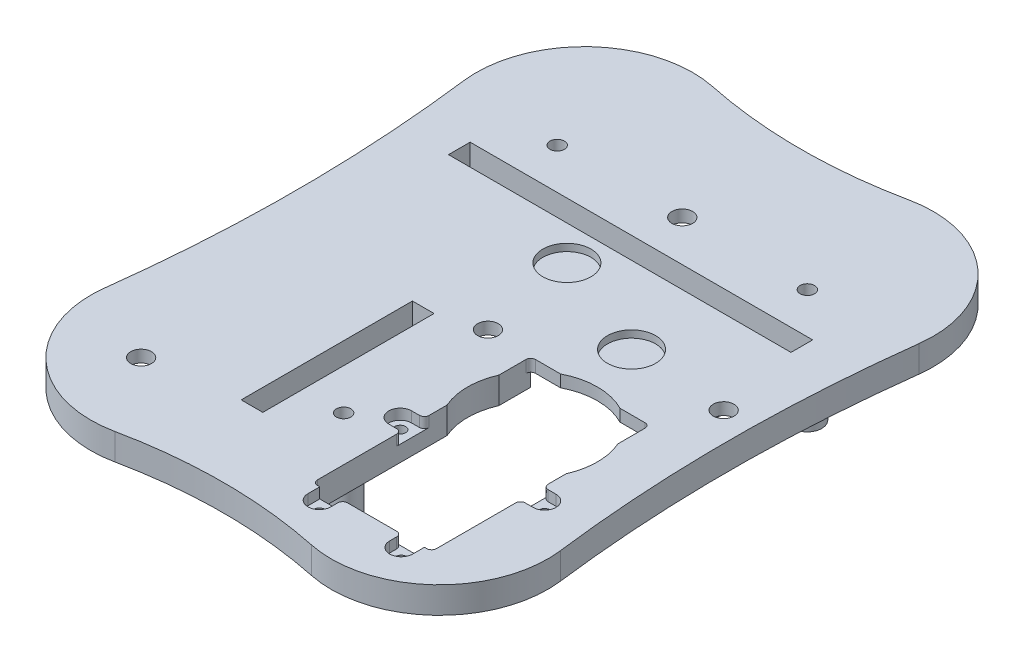
from build123d import *
from build123d.topology import SkipClean

# Parameters (mm, degrees)
A_BASE_O_OUTLINE_R                             = 0.75
A_BASE_O_OUTLINE_R_2                           = 1.5
A_BASE_O_DEPTH                                 = 1.5
SKETCH1_R                                      = 12
SKETCH1_R_2                                    = 5
GEAR_MOUNTING_HOLES_DEPTH                      = 83.615422454
BASE_START                                     = 1
SKETCH2_R                                      = 1.5
SKETCH2_R_2                                    = 0.75
SKETCH2_R_3                                    = 12
BASE_EXTENSION_DEPTH                           = 1
SKETCH3_W                                      = 71.2
SKETCH3_H                                      = 4.5
SKETCH3_W_2                                    = 4.5
SKETCH3_H_2                                    = 35.6
DYNAMIXEL_MOUNTING_SLOTS_DEPTH                 = 83.639627463
SKETCH4_W                                      = 24.55
SKETCH4_H                                      = 2.5
SKETCH4_W_2                                    = 2.5
SKETCH4_H_2                                    = 24.55
SKETCH4_W_3                                    = 15
SKETCH4_W_4                                    = 9
SKETCH4_H_3                                    = 18.55
SKETCH4_H_4                                    = 15
SKETCH4_W_5                                    = 18.55
SKETCH4_H_5                                    = 9
DYNAMIXEL_MOUNTING_PLATFORMS_DEPTH             = 3.1
DYNAMIXEL_MOUNTING_WALLS_DEPTH                 = 5.6
SKETCH6_R                                      = 0.5
SKETCH6_W                                      = 24.75
SKETCH6_H                                      = 45.35
GEAR_DYNAMIXEL_MOUNTING_HOLES_DEPTH            = 83.791412763
GEAR_START                                     = 3
SKETCH7_R                                      = 0.5
GEAR_DYNAMIXEL_MOUNTING_PLATFORMS_DEPTH        = 3
F_8_CLEARANCE_HOLE1_D                          = 4.3053
F_8_CLEARANCE_HOLE1_DEPTH                      = 26.4
F_8_CLEARANCE_HOLE1_TIP                        = 1.293442612
CBORE_FOR_2_SOCKET_HEAD_CAP_SCREW1_D           = 2.2606
CBORE_FOR_2_SOCKET_HEAD_CAP_SCREW1_CBORE_D     = 4.7625
CBORE_FOR_2_SOCKET_HEAD_CAP_SCREW1_CBORE_DEPTH = 2.1844
CBORE_CLEANUP_DEPTH                            = 2.1844
CONTOURING_R                                   = 1
SKETCH14_R                                     = 13.5
GEAR_CLEARANCE_DEPTH                           = 83.99800014
OUTER_START                                    = 3
OUTER_BRIM_DEPTH                               = 3
OUTER_BRIM_FILLER_DEPTH                        = 3
SKETCH18_R                                     = 3.4
CLEARANCE_POST_DEPTH                           = 3
TENDON_START                                   = 21
SKETCH21_R                                     = 3
SKETCH21_R_2                                   = 1.5
TENDON_POSTS_DEPTH                             = 21
TENDON_POST_CHAMFER_SIZE                       = 2
TENDON_POST_CHAMFER_SIZE2                      = 5.494954839
BACK_START                                     = 3
SKETCH22_R                                     = 1.5
BACK_TENDON_POST_BASE_DEPTH                    = 3
FILLET1_R                                      = 1


# Read off the part's stored shape, not the designer's step: a_base_o
with BuildPart() as part:
    # a_base_o outline → a_base_o (new body)
    with BuildSketch(Plane(origin=(0, 0, 0), x_dir=(1, 0, 0), z_dir=(0, 1, 0))):
        with BuildLine():
            ThreePointArc((-47.325593549, -42.28200295), (-40.253272085, -61.61865163), (-20.408173931, -67.104614834))
            ThreePointArc((-20.408173931, -67.104614834), (0, -65), (20.408173931, -67.104614834))
            ThreePointArc((20.408173931, -67.104614834), (40.253272085, -61.61865163), (47.325593549, -42.28200295))
            ThreePointArc((47.325593549, -42.28200295), (45, -5), (47.325593549, 32.28200295))
            ThreePointArc((47.325593549, 32.28200295), (40.253272085, 51.61865163), (20.408173931, 57.104614834))
            ThreePointArc((20.408173931, 57.104614834), (0, 55), (-20.408173931, 57.104614834))
            ThreePointArc((-20.408173931, 57.104614834), (-40.253272085, 51.61865163), (-47.325593549, 32.28200295))
            ThreePointArc((-47.325593549, 32.28200295), (-45, -5), (-47.325593549, -42.28200295))
        make_face()
        with Locations((-31.010420705, -51.088560812)):
            Circle(A_BASE_O_OUTLINE_R, mode=Mode.SUBTRACT)
        with Locations((0, -40)):
            Circle(A_BASE_O_OUTLINE_R_2, mode=Mode.SUBTRACT)
        with Locations((0, -10)):
            Circle(A_BASE_O_OUTLINE_R, mode=Mode.SUBTRACT)
        with Locations((-26, 30.397368307)):
            Circle(A_BASE_O_OUTLINE_R_2, mode=Mode.SUBTRACT)
        with Locations((39, 0)):
            Circle(A_BASE_O_OUTLINE_R, mode=Mode.SUBTRACT)
        with Locations((0, 30.397368307)):
            Circle(A_BASE_O_OUTLINE_R, mode=Mode.SUBTRACT)
        with Locations((26, 30.397368307)):
            Circle(A_BASE_O_OUTLINE_R_2, mode=Mode.SUBTRACT)
    extrude(amount=A_BASE_O_DEPTH)

    # Sketch1 → Gear Mounting Holes (cut, through all)
    with BuildSketch(Plane.XZ):
        with Locations(Location((21.7, 22.435716785, 0), (0, 0, 270))):
            Circle(SKETCH1_R)
        with Locations(Location((18.5, -1.349993211, 0), (0, 0, 270))):
            Circle(SKETCH1_R_2)
        with Locations(Location((-3.801906733, -10.21706466, 0), (0, 0, 270))):
            Circle(SKETCH1_R_2)
    extrude(amount=-GEAR_MOUNTING_HOLES_DEPTH, mode=Mode.SUBTRACT)

    # Sketch2 → Base Extension (add)
    with SkipClean():  # the faces are left unmerged after this step: merging them gives an invalid solid
        with BuildSketch(Plane.XZ.offset(BASE_START)):
            with BuildLine():
                ThreePointArc((-20.408173931, 67.104614834), (-40.253272085, 61.61865163), (-47.325593549, 42.28200295))
                ThreePointArc((-47.325593549, 42.28200295), (-45, 5), (-47.325593549, -32.28200295))
                ThreePointArc((-47.325593549, -32.28200295), (-40.253272085, -51.61865163), (-20.408173931, -57.104614834))
                ThreePointArc((-20.408173931, -57.104614834), (0, -55), (20.408173931, -57.104614834))
                ThreePointArc((20.408173931, -57.104614834), (40.253272085, -51.61865163), (47.325593549, -32.28200295))
                ThreePointArc((47.325593549, -32.28200295), (45, 5), (47.325593549, 42.28200295))
                ThreePointArc((47.325593549, 42.28200295), (40.253272085, 61.61865163), (20.408173931, 67.104614834))
                ThreePointArc((20.408173931, 67.104614834), (0, 65), (-20.408173931, 67.104614834))
            make_face()
            with Locations(Location((26, -30.397368307, 0), (0, 0, 270))):
                Circle(SKETCH2_R, mode=Mode.SUBTRACT)
            with Locations(Location((0, -30.397368307, 0), (0, 0, 90))):
                Circle(SKETCH2_R_2, mode=Mode.SUBTRACT)
            with Locations(Location((-26, -30.397368307, 0), (0, 0, 270))):
                Circle(SKETCH2_R, mode=Mode.SUBTRACT)
            with Locations(Location((39, 0, 0), (0, 0, 90))):
                Circle(SKETCH2_R_2, mode=Mode.SUBTRACT)
            with Locations(Location((0, 40, 0), (0, 0, 270))):
                Circle(SKETCH2_R, mode=Mode.SUBTRACT)
            with Locations(Location((-31.010420705, 51.088560812, 0), (0, 0, 90))):
                Circle(SKETCH2_R_2, mode=Mode.SUBTRACT)
            with Locations(Location((21.7, 22.435716785, 0), (0, 0, 270))):
                Circle(SKETCH2_R_3, mode=Mode.SUBTRACT)
        extrude(amount=-BASE_EXTENSION_DEPTH)

    # Sketch3 → Dynamixel Mounting Slots (cut, through all)
    with SkipClean():  # the faces are left unmerged after this step: merging them gives an invalid solid
        with BuildSketch(Plane.XZ.offset(1)):
            with Locations((0, -19.647368307)):
                Rectangle(SKETCH3_W, SKETCH3_H)
            with Locations((-10.75, 30.5)):
                Rectangle(SKETCH3_W_2, SKETCH3_H_2)
        extrude(amount=-DYNAMIXEL_MOUNTING_SLOTS_DEPTH, mode=Mode.SUBTRACT)

    # Sketch4 → Dynamixel Mounting Platforms (add)
    # profile 1 of 6: a face of its own
    with SkipClean():  # the faces are left unmerged after this step: merging them gives an invalid solid
        with BuildSketch(Plane.XZ.offset(1)):
            with Locations((17.8, -23.147368307)):
                Rectangle(SKETCH4_W, SKETCH4_H)
        # profile 2 of 6: a face of its own
        with BuildSketch(Plane.XZ.offset(1)):
            with Locations((-17.8, -23.147368307)):
                Rectangle(SKETCH4_W, SKETCH4_H)
        # profile 3 of 6: a face of its own
        with BuildSketch(Plane.XZ.offset(1)):
            with Locations((-7.25, 30.5)):
                Rectangle(SKETCH4_W_2, SKETCH4_H_2)
        # profile 4 of 6: a face of its own
        with BuildSketch(Plane.XZ.offset(1)):
            with Locations((-20.5, 30.5)):
                Rectangle(SKETCH4_W_3, SKETCH4_H_2)
            with Locations((-20.5, 30.5)):
                Rectangle(SKETCH4_W_4, SKETCH4_H_3, mode=Mode.SUBTRACT)
        # profile 5 of 6: a face of its own
        with BuildSketch(Plane.XZ.offset(1)):
            with Locations((17.8, -9.897368307)):
                Rectangle(SKETCH4_W, SKETCH4_H_4)
            with Locations((17.8, -9.897368307)):
                Rectangle(SKETCH4_W_5, SKETCH4_H_5, mode=Mode.SUBTRACT)
        # profile 6 of 6: a face of its own
        with BuildSketch(Plane.XZ.offset(1)):
            with Locations((-17.8, -9.897368307)):
                Rectangle(SKETCH4_W, SKETCH4_H_4)
            with Locations((-17.8, -9.897368307)):
                Rectangle(SKETCH4_W_5, SKETCH4_H_5, mode=Mode.SUBTRACT)
        extrude(amount=DYNAMIXEL_MOUNTING_PLATFORMS_DEPTH)

    # Sketch5 → Dynamixel Mounting Walls (add)
    with SkipClean():  # the faces are left unmerged after this step: merging them gives an invalid solid
        with BuildSketch(Plane.XZ.offset(1)):
            Polygon((30.075, -21.897368307), (35.6, -21.897368307), (35.6, -17.397368307), (30.075, -17.397368307), (30.075, -2.397368307), (31.575, -2.397368307), (31.575, -15.897368307), (37.1, -15.897368307), (37.1, -23.397368307), (37.1, -24.397368307), (30.075, -24.397368307), (30.075, -23.397368307), align=None)
            Polygon((-35.6, -21.897368307), (-30.075, -21.897368307), (-30.075, -23.397368307), (-30.075, -24.397368307), (-37.1, -24.397368307), (-37.1, -23.397368307), (-37.1, -15.897368307), (-31.575, -15.897368307), (-31.575, -2.397368307), (-30.075, -2.397368307), (-30.075, -17.397368307), (-35.6, -17.397368307), align=None)
            Polygon((5.525, -2.397368307), (5.525, -17.397368307), (-5.525, -17.397368307), (-5.525, -2.397368307), (-4.025, -2.397368307), (-4.025, -15.897368307), (4.025, -15.897368307), (4.025, -2.397368307), align=None)
            Polygon((-5.525, -21.897368307), (5.525, -21.897368307), (5.525, -23.397368307), (5.525, -24.397368307), (-5.525, -24.397368307), (-5.525, -23.397368307), align=None)
            Polygon((-8.5, 12.7), (-8.5, 18.225), (-7, 18.225), (-6, 18.225), (-6, 11.2), (-7, 11.2), (-14.5, 11.2), (-14.5, 16.725), (-28, 16.725), (-28, 18.225), (-13, 18.225), (-13, 12.7), align=None)
            Polygon((-8.5, 42.775), (-8.5, 48.3), (-13, 48.3), (-13, 42.775), (-28, 42.775), (-28, 44.275), (-14.5, 44.275), (-14.5, 49.8), (-7, 49.8), (-6, 49.8), (-6, 42.775), (-7, 42.775), align=None)
        extrude(amount=DYNAMIXEL_MOUNTING_WALLS_DEPTH)

    # Sketch6 → Gear Dynamixel Mounting Holes (cut, through all)
    with SkipClean():  # the faces are left unmerged after this step: merging them gives an invalid solid
        with BuildSketch(Plane.XZ.offset(1)):
            with Locations(Location((36.7, 34.935716785, 0), (0, 0, 270))):
                Circle(SKETCH6_R)
            with Locations(Location((30.2, 58.235716785, 0), (0, 0, 270))):
                Circle(SKETCH6_R)
            with Locations(Location((13.2, 58.235716785, 0), (0, 0, 270))):
                Circle(SKETCH6_R)
            with Locations(Location((6.7, 34.935716785, 0), (0, 0, 270))):
                Circle(SKETCH6_R)
            with Locations((21.7, 33.110716785)):
                Rectangle(SKETCH6_W, SKETCH6_H)
        extrude(amount=-GEAR_DYNAMIXEL_MOUNTING_HOLES_DEPTH, mode=Mode.SUBTRACT)

    # Sketch7 → Gear Dynamixel Mounting Platforms (add)
    with SkipClean():  # the faces are left unmerged after this step: merging them gives an invalid solid
        with BuildSketch(Plane.XZ.offset(1).offset(GEAR_START)):
            Polygon((34.075, 10.435716785), (34.075, 55.785716785), (9.325, 55.785716785), (9.325, 10.435716785), (3.7, 13.683312049), (3.7, 55.785716785), (9.325, 61.410716785), (34.075, 61.410716785), (39.7, 55.785716785), (39.7, 13.683312049), align=None)
            with Locations(Location((36.7, 34.935716785, 0), (0, 0, 270))):
                Circle(SKETCH7_R, mode=Mode.SUBTRACT)
            with Locations(Location((30.2, 58.235716785, 0), (0, 0, 270))):
                Circle(SKETCH7_R, mode=Mode.SUBTRACT)
            with Locations(Location((13.2, 58.235716785, 0), (0, 0, 270))):
                Circle(SKETCH7_R, mode=Mode.SUBTRACT)
            with Locations(Location((6.7, 34.935716785, 0), (0, 0, 270))):
                Circle(SKETCH7_R, mode=Mode.SUBTRACT)
        extrude(amount=-GEAR_DYNAMIXEL_MOUNTING_PLATFORMS_DEPTH)

    # #8 Clearance Hole1
    with Locations(Plane(origin=(0, 1.5, 0), x_dir=(1, 0, 0), z_dir=(0, 1, 0))):
        with Locations((0, 30.397368307), (-31.010420705, -51.088560812), (0, -10), (39, 0)):
            Hole(F_8_CLEARANCE_HOLE1_D / 2, depth=F_8_CLEARANCE_HOLE1_DEPTH)
            with Locations((0, 0, -(F_8_CLEARANCE_HOLE1_DEPTH + F_8_CLEARANCE_HOLE1_TIP / 2))):  # 118° drill point
                Cone(0, F_8_CLEARANCE_HOLE1_D / 2, F_8_CLEARANCE_HOLE1_TIP, mode=Mode.SUBTRACT)

    # CBORE for #2 Socket Head Cap Screw1 (through all)
    with Locations(Plane(origin=(0, 1.5, 0), x_dir=(1, 0, 0), z_dir=(0, 1, 0))):
        with Locations((36.7, -34.935716785), (30.2, -58.235716785), (13.2, -58.235716785), (6.7, -34.935716785)):
            CounterBoreHole(CBORE_FOR_2_SOCKET_HEAD_CAP_SCREW1_D / 2, CBORE_FOR_2_SOCKET_HEAD_CAP_SCREW1_CBORE_D / 2, CBORE_FOR_2_SOCKET_HEAD_CAP_SCREW1_CBORE_DEPTH)

    # Sketch13 → CBORE Cleanup (cut)
    with SkipClean():  # the faces are left unmerged after this step: merging them gives an invalid solid
        with BuildSketch(Plane(origin=(0, 1.5, 0), x_dir=(1, 0, 0), z_dir=(0, 1, 0))):
            with BuildLine():
                Line((6.7, -37.316966785), (9.325, -37.316966785))
                Line((9.325, -37.316966785), (9.325, -32.554466785))
                Line((9.325, -32.554466785), (6.7, -32.554466785))
                ThreePointArc((6.7, -32.554466785), (8.383798023, -33.251918762), (9.08125, -34.935716785))
                ThreePointArc((9.08125, -34.935716785), (8.383798023, -36.619514808), (6.7, -37.316966785))
            make_face()
            with BuildLine():
                Line((34.075, -32.554466785), (34.075, -37.316966785))
                Line((34.075, -37.316966785), (36.7, -37.316966785))
                ThreePointArc((36.7, -37.316966785), (34.31875, -34.935716785), (36.7, -32.554466785))
                Line((36.7, -32.554466785), (34.075, -32.554466785))
            make_face()
            with BuildLine():
                Line((15.58125, -58.235716785), (15.58125, -55.785716785))
                Line((15.58125, -55.785716785), (10.81875, -55.785716785))
                Line((10.81875, -55.785716785), (10.81875, -58.235716785))
                ThreePointArc((10.81875, -58.235716785), (13.2, -55.854466785), (15.58125, -58.235716785))
            make_face()
            with BuildLine():
                Line((32.58125, -58.235716785), (32.58125, -55.785716785))
                Line((32.58125, -55.785716785), (27.81875, -55.785716785))
                Line((27.81875, -55.785716785), (27.81875, -58.235716785))
                ThreePointArc((27.81875, -58.235716785), (30.2, -55.854466785), (32.58125, -58.235716785))
            make_face()
        extrude(amount=-CBORE_CLEANUP_DEPTH, mode=Mode.SUBTRACT)

    # Contouring
    # the kernel refuses this fillet: 1 mm, written as the material it adds along each edge
    with BuildSketch(Plane(origin=(34.075, -4, 55.785716785), x_dir=(-1, 0, 0), z_dir=(0, 1, 0))) as contouring_piece_1:
        with BuildLine():
            CenterArc((CONTOURING_R, -CONTOURING_R), CONTOURING_R, 90, 90)
            Line((0, -CONTOURING_R), (0, 0))
            Line((0, 0), (CONTOURING_R, 0))
        make_face()
    extrude(amount=3)
    with BuildSketch(Plane(origin=(9.325, -4, 55.785716785), x_dir=(1, 0, 0), z_dir=(0, 1, 0))) as contouring_piece_2:
        with BuildLine():
            CenterArc((CONTOURING_R, CONTOURING_R), CONTOURING_R, 180, 90)
            Line((0, CONTOURING_R), (0, 0))
            Line((0, 0), (CONTOURING_R, 0))
        make_face()
    extrude(amount=3)
    with BuildSketch(Plane(origin=(9.325, -1, 10.435716785), x_dir=(1, 0, 0), z_dir=(0, 1, 0)), Plane(origin=(34.075, -1, 10.435716785), x_dir=(0, 0, 1), z_dir=(0, 1, 0)), Plane(origin=(34.075, -1, 55.785716785), x_dir=(-1, 0, 0), z_dir=(0, 1, 0))) as contouring_piece_3:
        with BuildLine():
            CenterArc((CONTOURING_R, -CONTOURING_R), CONTOURING_R, 90, 90)
            Line((0, -CONTOURING_R), (0, 0))
            Line((0, 0), (CONTOURING_R, 0))
        make_face()
    extrude(amount=2.5)
    with BuildSketch(Plane(origin=(-14.5, 1.5, 16.725), x_dir=(-1, 0, 0), z_dir=(0, -1, 0)), Plane(origin=(-31.575, 1.5, -15.897368307), x_dir=(0, 0, 1), z_dir=(0, -1, 0)), Plane(origin=(4.025, 1.5, -15.897368307), x_dir=(0, 0, 1), z_dir=(0, -1, 0))) as contouring_piece_4:
        with BuildLine():
            CenterArc((CONTOURING_R, CONTOURING_R), CONTOURING_R, 180, 90)
            Line((0, CONTOURING_R), (0, 0))
            Line((0, 0), (CONTOURING_R, 0))
        make_face()
    extrude(amount=8.1)
    with BuildSketch(Plane(origin=(-14.5, 1.5, 44.275), x_dir=(-1, 0, 0), z_dir=(0, -1, 0)), Plane(origin=(31.575, 1.5, -15.897368307), x_dir=(0, 0, 1), z_dir=(0, -1, 0))) as contouring_piece_5:
        with BuildLine():
            CenterArc((CONTOURING_R, -CONTOURING_R), CONTOURING_R, 90, 90)
            Line((0, -CONTOURING_R), (0, 0))
            Line((0, 0), (CONTOURING_R, 0))
        make_face()
    extrude(amount=8.1)
    with BuildSketch(Plane(origin=(-4.025, 1.5, -15.897368307), x_dir=(1, 0, 0), z_dir=(0, -1, 0))) as contouring_piece_6_section:
        with BuildLine():
            CenterArc((CONTOURING_R, CONTOURING_R), CONTOURING_R, 180, 90)
            Line((0, CONTOURING_R), (0, 0))
            Line((0, 0), (CONTOURING_R, 0))
        make_face()
    contouring_piece_6 = extrude(amount=8.1, mode=Mode.PRIVATE)
    contouring_piece_6 = split(contouring_piece_6, bisect_by=Plane(origin=(-3.796335068, 0, -15.687736344), z_dir=(0, -1, 0)), keep=Keep.TOP, mode=Mode.PRIVATE)
    add(contouring_piece_6)
    with BuildSketch(Plane(origin=(9.325, -1, 55.785716785), x_dir=(1, 0, 0), z_dir=(0, 1, 0))) as contouring_piece_7:
        with BuildLine():
            CenterArc((CONTOURING_R, CONTOURING_R), CONTOURING_R, 180, 90)
            Line((0, CONTOURING_R), (0, 0))
            Line((0, 0), (CONTOURING_R, 0))
        make_face()
    extrude(amount=2.5)
    # the kernel refuses this fillet: 1 mm, written as the material it takes off along each edge
    with BuildSketch(Plane(origin=(34.075, -5.035533906, 61.410716785), x_dir=(0.7071067811865475, 0, -0.7071067811865475), z_dir=(0, 1, 0)), Plane(origin=(39.7, -5.035533906, 55.785716785), x_dir=(0, 0, -1), z_dir=(0, 1, 0)), Plane(origin=(9.325, -5.035533906, 61.410716785), x_dir=(1, 0, 0), z_dir=(0, 1, 0)), Plane(origin=(3.7, -5.035533906, 55.785716785), x_dir=(0.7071067811865427, 0, 0.7071067811865523), z_dir=(0, 1, 0))) as contouring_2_piece_1:
        with BuildLine():
            CenterArc((CONTOURING_R * 0.414213562373, CONTOURING_R), CONTOURING_R, 225, 45)
            Line((-CONTOURING_R * 0.292893218813, CONTOURING_R * 0.292893218813), (0, 0))
            Line((0, 0), (CONTOURING_R * 0.414213562373, 0))
        make_face()
    extrude(amount=4.035533906, mode=Mode.SUBTRACT)
    with BuildSketch(Plane(origin=(3.7, -5.443375673, 13.683312049), x_dir=(0, 0, 1), z_dir=(0, 1, 0)), Plane(origin=(39.7, -5.443375673, 13.683312049), x_dir=(-0.8660254037844412, 0, -0.49999999999999567), z_dir=(0, 1, 0))) as contouring_2_piece_2:
        with BuildLine():
            CenterArc((CONTOURING_R * 0.57735026919, CONTOURING_R), CONTOURING_R, 210, 60)
            Line((-CONTOURING_R * 0.288675134595, CONTOURING_R * 0.5), (0, 0))
            Line((0, 0), (CONTOURING_R * 0.57735026919, 0))
        make_face()
    extrude(amount=4.443375673, mode=Mode.SUBTRACT)
    with BuildSketch(Plane(origin=(27.575, -6.6, -2.397368307), x_dir=(0, 1, 0), z_dir=(1, 0, 0)), Plane(origin=(1.525, -6.6, -2.397368307), x_dir=(0, 1, 0), z_dir=(1, 0, 0)), Plane(origin=(-8.025, -6.6, -2.397368307), x_dir=(0, 1, 0), z_dir=(1, 0, 0)), Plane(origin=(-34.075, -6.6, -2.397368307), x_dir=(0, 1, 0), z_dir=(1, 0, 0)), Plane(origin=(-28, -6.6, 14.225), x_dir=(0, 1, 0), z_dir=(0, 0, 1)), Plane(origin=(-28, -6.6, 40.275), x_dir=(0, 1, 0), z_dir=(0, 0, 1))) as contouring_2_piece_3:
        with BuildLine():
            CenterArc((CONTOURING_R, -CONTOURING_R), CONTOURING_R, 90, 90)
            Line((0, -CONTOURING_R), (0, 0))
            Line((0, 0), (CONTOURING_R, 0))
        make_face()
    extrude(amount=6.5, mode=Mode.SUBTRACT)
    with BuildSketch(Plane(origin=(-30.075, -6.6, -19.397368307), x_dir=(-1, 0, 0), z_dir=(0, 0, -1)), Plane(origin=(-11, -6.6, 18.225), x_dir=(0, 0, -1), z_dir=(1, 0, 0))) as contouring_2_piece_4:
        with BuildLine():
            CenterArc((CONTOURING_R, CONTOURING_R), CONTOURING_R, 180, 90)
            Line((0, CONTOURING_R), (0, 0))
            Line((0, 0), (CONTOURING_R, 0))
        make_face()
    extrude(amount=7.5, mode=Mode.SUBTRACT)
    with BuildSketch(Plane(origin=(-5.525, -6.6, -26.897368307), x_dir=(0, 1, 0), z_dir=(0, 0, 1)), Plane(origin=(5.525, -6.6, -19.397368307), x_dir=(0, 1, 0), z_dir=(0, 0, -1)), Plane(origin=(30.075, -6.6, -26.897368307), x_dir=(0, 1, 0), z_dir=(0, 0, 1)), Plane(origin=(-3.5, -6.6, 42.775), x_dir=(0, 1, 0), z_dir=(-1, 0, 0))) as contouring_2_piece_5:
        with BuildLine():
            CenterArc((CONTOURING_R, -CONTOURING_R), CONTOURING_R, 90, 90)
            Line((0, -CONTOURING_R), (0, 0))
            Line((0, 0), (CONTOURING_R, 0))
        make_face()
    extrude(amount=7.5, mode=Mode.SUBTRACT)
    with BuildSketch(Plane(origin=(30.075, -4.1, -17.397368307), x_dir=(1, 0, 0), z_dir=(0, -1, 0)), Plane(origin=(-5.525, -4.1, -17.397368307), x_dir=(1, 0, 0), z_dir=(0, -1, 0)), Plane(origin=(-13, -4.1, 42.775), x_dir=(0, 0, 1), z_dir=(0, -1, 0))) as contouring_2_piece_6:
        with BuildLine():
            CenterArc((CONTOURING_R, CONTOURING_R), CONTOURING_R, 180, 90)
            Line((0, CONTOURING_R), (0, 0))
            Line((0, 0), (CONTOURING_R, 0))
        make_face()
    extrude(amount=5, mode=Mode.SUBTRACT)
    with BuildSketch(Plane(origin=(5.525, -4.1, -17.397368307), x_dir=(-1, 0, 0), z_dir=(0, -1, 0)), Plane(origin=(-30.075, -4.1, -17.397368307), x_dir=(-1, 0, 0), z_dir=(0, -1, 0)), Plane(origin=(-13, -4.1, 18.225), x_dir=(0, 0, -1), z_dir=(0, -1, 0))) as contouring_2_piece_7:
        with BuildLine():
            CenterArc((CONTOURING_R, -CONTOURING_R), CONTOURING_R, 90, 90)
            Line((0, -CONTOURING_R), (0, 0))
            Line((0, 0), (CONTOURING_R, 0))
        make_face()
    extrude(amount=5, mode=Mode.SUBTRACT)
    with BuildSketch(Plane(origin=(9.325, 4, 37.316966785), x_dir=(0, 0, 1), z_dir=(0, -1, 0)), Plane(origin=(34.075, 4, 32.554466785), x_dir=(0, 0, -1), z_dir=(0, -1, 0))) as contouring_2_piece_8:
        with BuildLine():
            CenterArc((CONTOURING_R, CONTOURING_R), CONTOURING_R, 180, 90)
            Line((0, CONTOURING_R), (0, 0))
            Line((0, 0), (CONTOURING_R, 0))
        make_face()
    extrude(amount=4.6844, mode=Mode.SUBTRACT)
    with BuildSketch(Plane(origin=(27.81875, 4, 55.785716785), x_dir=(-1, 0, 0), z_dir=(0, -1, 0)), Plane(origin=(15.58125, 4, 55.785716785), x_dir=(0, 0, 1), z_dir=(0, -1, 0)), Plane(origin=(34.075, 4, 37.316966785), x_dir=(0, 0, 1), z_dir=(0, -1, 0)), Plane(origin=(9.325, 4, 32.554466785), x_dir=(0, 0, -1), z_dir=(0, -1, 0))) as contouring_2_piece_9:
        with BuildLine():
            CenterArc((CONTOURING_R, -CONTOURING_R), CONTOURING_R, 90, 90)
            Line((0, -CONTOURING_R), (0, 0))
            Line((0, 0), (CONTOURING_R, 0))
        make_face()
    extrude(amount=4.6844, mode=Mode.SUBTRACT)

    # Sketch14 → Gear Clearance (cut, through all)
    with BuildSketch(Plane(origin=(0, 1.5, 0), x_dir=(1, 0, 0), z_dir=(0, 1, 0))):
        with Locations((21.7, -22.435716785)):
            Circle(SKETCH14_R)
    extrude(amount=-GEAR_CLEARANCE_DEPTH, mode=Mode.SUBTRACT)

    # Sketch16 → Outer Brim (add)
    with BuildSketch(Plane.XZ.offset(1).offset(OUTER_START)):
        with BuildLine():
            ThreePointArc((-20.408173931, 67.104614834), (0, 65), (20.408173931, 67.104614834))
            ThreePointArc((20.408173931, 67.104614834), (40.253272085, 61.61865163), (47.325593549, 42.28200295))
            ThreePointArc((47.325593549, 42.28200295), (45, 5), (47.325593549, -32.28200295))
            ThreePointArc((47.325593549, -32.28200295), (40.253272085, -51.61865163), (20.408173931, -57.104614834))
            ThreePointArc((20.408173931, -57.104614834), (0, -55), (-20.408173931, -57.104614834))
            ThreePointArc((-20.408173931, -57.104614834), (-40.253272085, -51.61865163), (-47.325593549, -32.28200295))
            ThreePointArc((-47.325593549, -32.28200295), (-45, 5), (-47.325593549, 42.28200295))
            ThreePointArc((-47.325593549, 42.28200295), (-40.253272085, 61.61865163), (-20.408173931, 67.104614834))
        make_face()
        with BuildLine():
            ThreePointArc((21.428582627, -52.209845576), (36.86365897, -47.942985306), (42.364353441, -32.903369666))
            ThreePointArc((42.364353441, -32.903369666), (40, 5), (42.364353441, 42.903369666))
            ThreePointArc((42.364353441, 42.903369666), (36.86365897, 57.942985306), (21.428582627, 62.209845576))
            ThreePointArc((21.428582627, 62.209845576), (0, 60), (-21.428582627, 62.209845576))
            ThreePointArc((-21.428582627, 62.209845576), (-36.86365897, 57.942985306), (-42.364353441, 42.903369666))
            ThreePointArc((-42.364353441, 42.903369666), (-40, 5), (-42.364353441, -32.903369666))
            ThreePointArc((-42.364353441, -32.903369666), (-36.86365897, -47.942985306), (-21.428582627, -52.209845576))
            ThreePointArc((-21.428582627, -52.209845576), (0, -50), (21.428582627, -52.209845576))
        make_face(mode=Mode.SUBTRACT)
    extrude(amount=-OUTER_BRIM_DEPTH)

    # Sketch17 → Outer Brim Filler (add)
    with BuildSketch(Plane.XZ.offset(1).offset(OUTER_START)):
        with BuildLine():
            Line((17.154020025, 61.410716785), (31.284706042, 61.410716785))
            ThreePointArc((31.284706042, 61.410716785), (26.41426202, 62.520913844), (21.428582627, 62.209845576))
            ThreePointArc((21.428582627, 62.209845576), (19.295438802, 61.788149704), (17.154020025, 61.410716785))
        make_face()
        with BuildLine():
            Line((39.7, 14.260662319), (39.7, 54.573435374))
            ThreePointArc((39.7, 54.573435374), (42.061017722, 48.973293748), (42.364353441, 42.903369666))
            ThreePointArc((42.364353441, 42.903369666), (40.881833224, 28.176294714), (40.11554636, 13.394636915))
            Line((40.11554636, 13.394636915), (39.2, 13.394636915))
            ThreePointArc((39.2, 13.394636915), (39.566025404, 13.760662319), (39.7, 14.260662319))
        make_face()
    extrude(amount=-OUTER_BRIM_FILLER_DEPTH)

    # Sketch18 → Clearance - Post (cut)
    with BuildSketch(Plane.XZ.offset(1)):
        with Locations((39, 0)):
            Circle(SKETCH18_R)
    extrude(amount=CLEARANCE_POST_DEPTH, mode=Mode.SUBTRACT)

    # Sketch21 → Tendon Posts (add)
    # profile 1 of 3: a face of its own
    with BuildSketch(Plane.XZ.offset(1).offset(TENDON_START)):
        with Locations(Location((26, -30.397368307, 0), (0, 0, 90))):
            Circle(SKETCH21_R)
        with Locations(Location((26, -30.397368307, 0), (0, 0, 270))):
            Circle(SKETCH21_R_2, mode=Mode.SUBTRACT)
    # profile 2 of 3: a face of its own
    with BuildSketch(Plane.XZ.offset(1).offset(TENDON_START)):
        with Locations(Location((-26, -30.397368307, 0), (0, 0, 90))):
            Circle(SKETCH21_R)
        with Locations(Location((-26, -30.397368307, 0), (0, 0, 270))):
            Circle(SKETCH21_R_2, mode=Mode.SUBTRACT)
    # profile 3 of 3: a face of its own
    with BuildSketch(Plane.XZ.offset(1).offset(TENDON_START)):
        with Locations(Location((0, 40, 0), (0, 0, 90))):
            Circle(SKETCH21_R)
        with Locations(Location((0, 40, 0), (0, 0, 270))):
            Circle(SKETCH21_R_2, mode=Mode.SUBTRACT)
    extrude(amount=-TENDON_POSTS_DEPTH)

    # Tendon Post Chamfer
    tendon_post_chamfer_edges = [part.edges().sort_by_distance(p)[0] for p in [
        (26, -1, -33.397368307),
        (-26, -1, -33.397368307),
    ]]
    tendon_post_chamfer_side = [part.faces().sort_by_distance(p)[0] for p in [
        (12.920170781, -1, 9.004424385),
    ]]
    chamfer(tendon_post_chamfer_edges, length=TENDON_POST_CHAMFER_SIZE, length2=TENDON_POST_CHAMFER_SIZE2, reference=tendon_post_chamfer_side[0])

    # Sketch22 → Back Tendon Post Base (add)
    with BuildSketch(Plane.XZ.offset(1).offset(BACK_START)):
        with BuildLine():
            Line((3.7, 43), (3.7, 37))
            Line((3.7, 37), (0, 37))
            ThreePointArc((0, 37), (-3, 40), (0, 43))
            Line((0, 43), (3.7, 43))
        make_face()
        with Locations(Location((0, 40, 0), (0, 0, 270))):
            Circle(SKETCH22_R, mode=Mode.SUBTRACT)
    extrude(amount=-BACK_TENDON_POST_BASE_DEPTH)

    # Fillet1
    fillet1_edges = [part.edges().sort_by_distance(p)[0] for p in [
        (40.005031655, -2.5, 3.248062711),
        (40.110612637, -2.5, -3.213493359),
        (3.7, -2.5, 43),
        (3.7, -2.5, 37),
        (8.237942511, -2.5, 60.323659296),
    ]]
    fillet(fillet1_edges, radius=FILLET1_R)


solid = part.part
